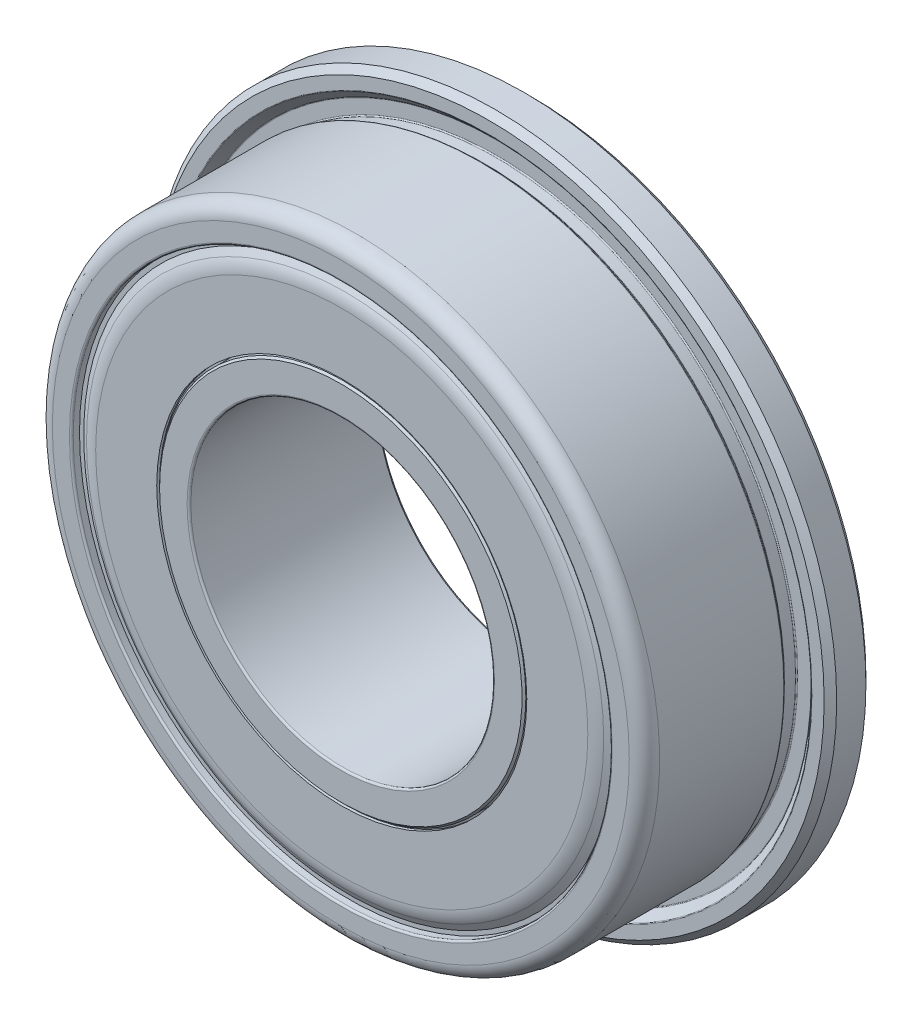
from build123d import *

# Parameters (mm, degrees)
CIRPATTERN1_COUNT  = 10
SKETCH9_R          = 4.875
CUT_EXTRUDE1_DEPTH = 13.359232379
SKETCH7_W          = 1.1
SKETCH7_H          = 1.9
FILLET2_R          = 0.4
FILLET3_R          = 0.05
FILLET5_R          = 0.03
CHAMFER1_SIZE      = 0.165
FILLET7_R          = 0.05


with BuildPart() as part:
    # Sketch3 → Revolve1 (revolve)
    with BuildSketch(Plane(origin=(0, 0, 0), x_dir=(0, 0, -1), z_dir=(1, 0, 0)), mode=Mode.PRIVATE) as revolve1_sk:
        with BuildLine():
            Line((-2.5, 8), (-2.5, 7.1))
            Line((-2.5, 7.1), (-0.708931057, 7.1))
            Line((-0.708931057, 7.1), (-0.708931057, 6.645))
            Line((-0.708931057, 6.645), (-0.508931057, 6.645))
            ThreePointArc((-0.508931057, 6.645), (0, 6.779517348), (0.508931057, 6.645))
            Line((0.508931057, 6.645), (0.708931057, 6.645))
            Line((0.708931057, 6.645), (0.708931057, 7.1))
            Line((0.708931057, 7.1), (2.5, 7.1))
            Line((2.5, 7.1), (2.5, 8))
            Line((2.5, 8), (-2.5, 8))
        make_face()
        with BuildLine():
            Line((2.5, 4), (-2.5, 4))
            Line((-2.5, 4), (-2.5, 4.825))
            Line((-2.5, 4.825), (-0.508931057, 4.825))
            ThreePointArc((-0.508931057, 4.825), (0, 4.719517348), (0.508931057, 4.825))
            Line((0.508931057, 4.825), (2.5, 4.825))
            Line((2.5, 4.825), (2.5, 4))
        make_face()
    revolve(revolve1_sk.sketch.rotate(Axis((0, 0, 2.5), (0, 0, -1)), 90), axis=Axis((0, 0, 2.5), (0, 0, -1)))

    # Sketch7 → Revolve5 (revolve)
    with BuildSketch(Plane(origin=(0, 0, 0), x_dir=(0, 0, -1), z_dir=(1, 0, 0)), mode=Mode.PRIVATE) as revolve5_sk:
        with Locations((1.95, 8.05)):
            Rectangle(SKETCH7_W, SKETCH7_H)
    revolve(revolve5_sk.sketch.rotate(Axis((0, 0, -2.5), (0, 0, 1)), 270), axis=Axis((0, 0, -2.5), (0, 0, 1)))

    # Fillet2
    fillet2_edges = [part.edges().sort_by_distance(p)[0] for p in [
        (-8, 0, 2.5),
    ]]
    fillet(fillet2_edges, radius=FILLET2_R)

    # Fillet3
    fillet3_edges = [part.edges().sort_by_distance(p)[0] for p in [
        (-7.1, 0, 0.708931057),
        (-7.1, 0, 2.5),
        (-7.1, 0, -2.5),
        (-7.1, 0, -0.708931057),
    ]]
    fillet(fillet3_edges, radius=FILLET3_R)

    # Fillet6
    # the kernel refuses this chamfer: 0.05 mm, written as the material it takes off along each edge
    with BuildSketch(Plane(origin=(0, 0, 2.5), x_dir=(1, 0, 0), z_dir=(0, 1, 0))) as fillet6_piece_1:
        with BuildLine():
            Line((4.773585786, -0.001414214), (4.826414214, 0.051414214))
            Line((4.826414214, 0.051414214), (4.827414214, 0.051414214))
            ThreePointArc((4.827414214, 0.051414214), (4.826, 0.025707107), (4.826, 0))
            Line((4.826, 0), (4.825, -0.001))
            ThreePointArc((4.825, -0.001), (4.799292893, -0.001), (4.773585786, -0.002414214))
            Line((4.773585786, -0.002414214), (4.773585786, -0.001414214))
        make_face()
    revolve(axis=Axis((0, 0, 2.5), (0, 0, -1)), mode=Mode.SUBTRACT)
    with BuildSketch(Plane(origin=(0, 0, 0.508931057), x_dir=(1, 0, 0), z_dir=(0, 1, 0))) as fillet6_piece_2:
        with BuildLine():
            Line((4.8253982, -0.012219701), (4.820637726, 0.011211587))
            Line((4.820637726, 0.011211587), (4.821558444, 0.011601814))
            ThreePointArc((4.821558444, 0.011601814), (4.823542985, 0.005915405), (4.825917623, 0.000397453))
            Line((4.825917623, 0.000397453), (4.826, 0))
            ThreePointArc((4.826, 0), (4.826, -0.00610985), (4.8263982, -0.012219701))
            Line((4.8263982, -0.012219701), (4.8253982, -0.012219701))
        make_face()
    revolve(axis=Axis((0, 0, 0.508931057), (0, 0, -1)), mode=Mode.SUBTRACT)
    with BuildSketch(Plane(origin=(0, 0, -0.508931057), x_dir=(1, 0, 0), z_dir=(0, 1, 0))) as fillet6_piece_3:
        with BuildLine():
            Line((4.8253982, 0.012219701), (4.820637726, -0.011211587))
            Line((4.820637726, -0.011211587), (4.821558444, -0.011601814))
            ThreePointArc((4.821558444, -0.011601814), (4.823542985, -0.005915405), (4.825917623, -0.000397453))
            Line((4.825917623, -0.000397453), (4.826, 0))
            ThreePointArc((4.826, 0), (4.826, 0.00610985), (4.8263982, 0.012219701))
            Line((4.8263982, 0.012219701), (4.8253982, 0.012219701))
        make_face()
    revolve(axis=Axis((0, 0, -0.508931057), (0, 0, -1)), mode=Mode.SUBTRACT)
    with BuildSketch(Plane(origin=(0, 0, -2.5), x_dir=(1, 0, 0), z_dir=(0, 1, 0))) as fillet6_piece_4:
        with BuildLine():
            Line((4.826414214, -0.051414214), (4.773585786, 0.001414214))
            Line((4.773585786, 0.001414214), (4.773585786, 0.002414214))
            ThreePointArc((4.773585786, 0.002414214), (4.799292893, 0.001), (4.825, 0.001))
            Line((4.825, 0.001), (4.826, 0))
            ThreePointArc((4.826, 0), (4.826, -0.025707107), (4.827414214, -0.051414214))
            Line((4.827414214, -0.051414214), (4.826414214, -0.051414214))
        make_face()
    revolve(axis=Axis((0, 0, -2.5), (0, 0, -1)), mode=Mode.SUBTRACT)

    # Sketch8 → Cut-Revolve1 (revolve, cut)
    with BuildSketch(Plane(origin=(0, 0, 0), x_dir=(0, 0, -1), z_dir=(1, 0, 0)), mode=Mode.PRIVATE) as cut_revolve1_sk:
        Polygon((1.4, 8.5), (1.62, 8.28), (1.62, 7.89), (1.29, 7.89), (1.18, 8), (1.4, 8), align=None)
    revolve(cut_revolve1_sk.sketch.rotate(Axis((0, 0, 2.5), (0, 0, -1)), 270), axis=Axis((0, 0, 2.5), (0, 0, -1)), mode=Mode.SUBTRACT)

    # Fillet5
    fillet5_edges = [part.edges().sort_by_distance(p)[0] for p in [
        (8.5, 0, -1.4),
        (0, 8, -1.18),
        (7.89, 0, -1.29),
        (7.89, 0, -1.62),
        (8.28, 0, -1.62),
    ]]
    fillet(fillet5_edges, radius=FILLET5_R)

    # Chamfer1
    chamfer1_edges = [part.edges().sort_by_distance(p)[0] for p in [
        (-9, 0, -2.5),
        (-9, 0, -1.4),
    ]]
    chamfer(chamfer1_edges, length=CHAMFER1_SIZE)

    # Fillet7
    fillet7_edges = [part.edges().sort_by_distance(p)[0] for p in [
        (-4, 0, -2.5),
        (-4, 0, 2.5),
    ]]
    fillet(fillet7_edges, radius=FILLET7_R)


with BuildPart() as body_2:
    # Sketch5 → Revolve3 (revolve)
    with BuildSketch(Plane(origin=(0, 0, 0), x_dir=(0, 0, -1), z_dir=(1, 0, 0))):
        with BuildLine():
            Line((-1, 5.749517348), (1, 5.749517348))
            ThreePointArc((1, 5.749517348), (0, 6.749517348), (-1, 5.749517348))
        make_face()
    revolve(axis=Axis((0, 5.749517348, 1), (0, 0, -1)))


with BuildPart() as cirpattern1_1:
    # CirPattern1: pattern copy
    add(body_2.part.rotate(Axis((0, 0, 0), (0, 0, 1)), 1 * 360 / CIRPATTERN1_COUNT))


with BuildPart() as cirpattern1_2:
    # CirPattern1: pattern copy
    add(body_2.part.rotate(Axis((0, 0, 0), (0, 0, 1)), 2 * 360 / CIRPATTERN1_COUNT))


with BuildPart() as cirpattern1_3:
    # CirPattern1: pattern copy
    add(body_2.part.rotate(Axis((0, 0, 0), (0, 0, 1)), 3 * 360 / CIRPATTERN1_COUNT))


with BuildPart() as cirpattern1_4:
    # CirPattern1: pattern copy
    add(body_2.part.rotate(Axis((0, 0, 0), (0, 0, 1)), 4 * 360 / CIRPATTERN1_COUNT))


with BuildPart() as cirpattern1_5:
    # CirPattern1: pattern copy
    add(body_2.part.rotate(Axis((0, 0, 0), (0, 0, 1)), 5 * 360 / CIRPATTERN1_COUNT))


with BuildPart() as cirpattern1_6:
    # CirPattern1: pattern copy
    add(body_2.part.rotate(Axis((0, 0, 0), (0, 0, 1)), 6 * 360 / CIRPATTERN1_COUNT))


with BuildPart() as cirpattern1_7:
    # CirPattern1: pattern copy
    add(body_2.part.rotate(Axis((0, 0, 0), (0, 0, 1)), 7 * 360 / CIRPATTERN1_COUNT))


with BuildPart() as cirpattern1_8:
    # CirPattern1: pattern copy
    add(body_2.part.rotate(Axis((0, 0, 0), (0, 0, 1)), 8 * 360 / CIRPATTERN1_COUNT))


with BuildPart() as cirpattern1_9:
    # CirPattern1: pattern copy
    add(body_2.part.rotate(Axis((0, 0, 0), (0, 0, 1)), 9 * 360 / CIRPATTERN1_COUNT))


with BuildPart() as body_12:
    # Sketch6 → Revolve4 (revolve)
    with BuildSketch(Plane(origin=(0, 0, 0), x_dir=(0, 0, -1), z_dir=(1, 0, 0)), mode=Mode.PRIVATE) as revolve4_sk:
        with BuildLine():
            Line((-2.475, 4.825), (-2.475, 6.483153533))
            ThreePointArc((-2.475, 6.483153533), (-2.452511045, 6.653974103), (-2.386576766, 6.813153533))
            Line((-2.386576766, 6.813153533), (-2.284474411, 6.99))
            Line((-2.284474411, 6.99), (-2.284474411, 7.1))
            Line((-2.284474411, 7.1), (-2.197871871, 7.1))
            Line((-2.197871871, 7.1), (-2.197871871, 6.99))
            Line((-2.197871871, 6.99), (-2.4, 6.639903811))
            Line((-2.4, 6.639903811), (-2.4, 4.825))
            Line((-2.4, 4.825), (-2.475, 4.825))
        make_face()
    revolve(revolve4_sk.sketch.rotate(Axis((0, 0, 2.5), (0, 0, -1)), 90), axis=Axis((0, 0, 2.5), (0, 0, -1)))


with BuildPart() as body_13:
    # Mirror1: mirrored copy
    add(body_12.part.mirror(Plane.XY))


with BuildPart() as cut_extrude1_tool:
    # Sketch9 → Cut-Extrude1 (new, through all)
    with BuildSketch(Plane.XY.offset(2.475)):
        Circle(SKETCH9_R)
    extrude(amount=-CUT_EXTRUDE1_DEPTH)


with BuildPart() as body_12_1:
    add(body_12.part)

    # Cut-Extrude1: cut by cut_extrude1_tool
    add(cut_extrude1_tool.part, mode=Mode.SUBTRACT)


with BuildPart() as body_13_1:
    add(body_13.part)

    # Cut-Extrude1: cut by cut_extrude1_tool
    add(cut_extrude1_tool.part, mode=Mode.SUBTRACT)


solid = Compound([part.part, body_2.part, cirpattern1_1.part, cirpattern1_2.part, cirpattern1_3.part, cirpattern1_4.part, cirpattern1_5.part, cirpattern1_6.part, cirpattern1_7.part, cirpattern1_8.part, cirpattern1_9.part, body_12_1.part, body_13_1.part])
